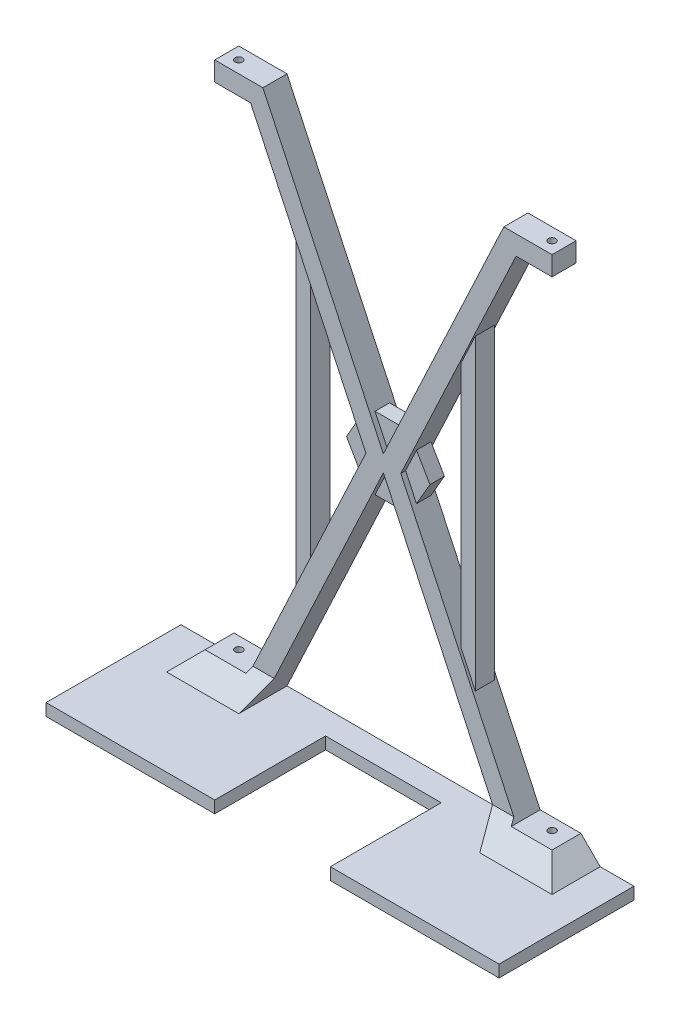
from build123d import *

# Parameters (mm, degrees)
EXTRUDE_1_DEPTH     = 5
SKETCH_2_R          = 1.55
CUT_EXTRUDE_1_DEPTH = 234
EXTRUDE_3_DEPTH     = 3
SKETCH_4_W          = 188
SKETCH_4_H          = 10
EXTRUDE_4_DEPTH     = 5
SKETCH_5_W          = 70
SKETCH_5_H          = 46
EXTRUDE_5_DEPTH     = 5
EXTRUDE_6_DEPTH     = 4
CHAMFER_1_SIZE      = 10


with BuildPart() as part:
    # 草图1 → 凸台-拉伸1 (new, symmetric)
    with BuildSketch(Plane.XY):
        Polygon((-55.084006936, 98.602863112), (-7.242890373, -3.397136888), (0, 0), (-50, 106.602863112), (-70, 106.602863112), (-70, 98.602863112), align=None)
        Polygon((70, 106.602863112), (70, 98.602863112), (55.084006936, 98.602863112), (7.242890373, -3.397136888), (0, 0), (50, 106.602863112), align=None)
        Polygon((-70, -113.397136888), (-70, -105.397136888), (-55.084006936, -105.397136888), (-7.242890373, -3.397136888), (0, -6.794273777), (-50, -113.397136888), align=None)
        Polygon((55.084006936, -105.397136888), (7.242890373, -3.397136888), (0, -6.794273777), (50, -113.397136888), (70, -113.397136888), (70, -105.397136888), align=None)
        Polygon((-7.242890373, -3.397136888), (0, 0), (7.242890373, -3.397136888), align=None)
        Polygon((-7.242890373, -3.397136888), (7.242890373, -3.397136888), (0, -6.794273777), align=None)
    extrude(amount=EXTRUDE_1_DEPTH, both=True)

    # 草图2 → 切除-拉伸1 (cut)
    with BuildSketch(Plane(origin=(0, 106.602863112, 0), x_dir=(1, 0, 0), z_dir=(0, 1, 0))):
        with Locations(Location((-65, 0, 0), (0, 0, 180))):
            Circle(SKETCH_2_R)
        with Locations(Location((65, 0, 0), (0, 0, 180))):
            Circle(SKETCH_2_R)
    extrude(amount=-CUT_EXTRUDE_1_DEPTH, mode=Mode.SUBTRACT)

    # 草图3 → 凸台-拉伸3 (add, symmetric)
    with BuildSketch(Plane.XY):
        Polygon((8.660254038, 11.602863112), (-8.660254038, 11.602863112), (-17.320508076, -3.397136888), (-8.660254038, -18.397136888), (8.660254038, -18.397136888), (17.320508076, -3.397136888), align=None)
    extrude(amount=EXTRUDE_3_DEPTH, both=True)

    # 草图4 → 凸台-拉伸4 (add)
    with BuildSketch(Plane.XZ.offset(113.397136888)):
        Rectangle(SKETCH_4_W, SKETCH_4_H)
    extrude(amount=EXTRUDE_4_DEPTH)

    # 草图5 → 凸台-拉伸5 (add)
    with BuildSketch(Plane.XZ.offset(118.397136888)):
        with Locations((59, 28)):
            Rectangle(SKETCH_5_W, SKETCH_5_H)
        with Locations((-59, 28)):
            Rectangle(SKETCH_5_W, SKETCH_5_H)
    extrude(amount=-EXTRUDE_5_DEPTH)

    # 草图6 → 凸台-拉伸6 (add, symmetric)
    with BuildSketch(Plane.XY):
        Polygon((-31.163448655, 47.602863112), (-31.163448655, -54.397136888), (-37.163448655, -67.189480462), (-37.163448655, 60.395206685), align=None)
        Polygon((37.163448655, -67.189480462), (31.163448655, -54.397136888), (31.163448655, 47.602863112), (37.163448655, 60.395206685), align=None)
    extrude(amount=EXTRUDE_6_DEPTH, both=True)

    # 倒角1
    # the kernel refuses this chamfer: 10 mm, written as the material it adds along each edge
    with BuildSketch(Plane(origin=(-70, -113.397136888, 5), x_dir=(0, -0.0274958766105877, 0.9996219169112968), z_dir=(1, 0, 0))) as chamfer_1_piece_1_section:
        Polygon((CHAMFER_1_SIZE * 0.999621916911, -CHAMFER_1_SIZE * 0.0274958766106), (-CHAMFER_1_SIZE * 0.0274958766106, -CHAMFER_1_SIZE * 0.999621916911), (0, 0), align=None)
    chamfer_1_piece_1 = extrude(amount=45.71682988, mode=Mode.PRIVATE)
    chamfer_1_piece_1 = split(chamfer_1_piece_1, bisect_by=Plane(origin=(-58.48678517, -112.652054934, 8.358509751), z_dir=(-0.9053612966848448, 0.4246421110360305, 0)), keep=Keep.TOP, mode=Mode.PRIVATE)
    chamfer_1_piece_1 = split(chamfer_1_piece_1, bisect_by=Plane(origin=(-63.672942129, -105.397136888, 8.358509751), z_dir=(0, -1, 0)), keep=Keep.TOP, mode=Mode.PRIVATE)
    add(chamfer_1_piece_1)
    with BuildSketch(Plane(origin=(-70, -113.397136888, 5), x_dir=(0, -0.0274958766105877, 0.9996219169112968), z_dir=(1, 0, 0))) as chamfer_1_piece_2_section:
        Polygon((CHAMFER_1_SIZE * 0.999621916911, -CHAMFER_1_SIZE * 0.0274958766106), (-CHAMFER_1_SIZE * 0.0274958766106, -CHAMFER_1_SIZE * 0.999621916911), (0, 0), align=None)
    chamfer_1_piece_2 = extrude(amount=45.71682988, mode=Mode.PRIVATE)
    chamfer_1_piece_2 = split(chamfer_1_piece_2, bisect_by=Plane(origin=(-49.392291056, -112.10146662, 8.457184123), z_dir=(-0.9053612966848449, 0.42464211103603033, 0)), keep=Keep.TOP, mode=Mode.PRIVATE)
    chamfer_1_piece_2 = split(chamfer_1_piece_2, bisect_by=Plane(origin=(-56.635181429, -108.704329732, 8.457184123), z_dir=(0.9053612966848448, -0.4246421110360305, 0)), keep=Keep.TOP, mode=Mode.PRIVATE)
    chamfer_1_piece_2 = split(chamfer_1_piece_2, bisect_by=Plane(origin=(-53.013736242, -105.397136888, 8.457184123), z_dir=(0, -1, 0)), keep=Keep.TOP, mode=Mode.PRIVATE)
    add(chamfer_1_piece_2)
    with BuildSketch(Plane(origin=(-70, -113.397136888, 5), x_dir=(0, -0.0274958766105877, 0.9996219169112968), z_dir=(1, 0, 0))) as chamfer_1_piece_3_section:
        Polygon((CHAMFER_1_SIZE * 0.999621916911, -CHAMFER_1_SIZE * 0.0274958766106), (-CHAMFER_1_SIZE * 0.0274958766106, -CHAMFER_1_SIZE * 0.999621916911), (0, 0), align=None)
    chamfer_1_piece_3 = extrude(amount=45.71682988, mode=Mode.PRIVATE)
    chamfer_1_piece_3 = split(chamfer_1_piece_3, bisect_by=Plane(origin=(-46.659786315, -106.275610043, 5.402318693), z_dir=(-0.9053612966848449, 0.42464211103603033, 0)), keep=Keep.TOP, mode=Mode.PRIVATE)
    chamfer_1_piece_3 = split(chamfer_1_piece_3, bisect_by=Plane(origin=(-53.902676688, -102.878473155, 5.402318693), z_dir=(0.9053612966848448, -0.4246421110360305, 0)), keep=Keep.TOP, mode=Mode.PRIVATE)
    chamfer_1_piece_3 = split(chamfer_1_piece_3, bisect_by=Plane(origin=(-50.281231501, -105.397136888, 5.402318693), z_dir=(0, 1, 0)), keep=Keep.TOP, mode=Mode.PRIVATE)
    add(chamfer_1_piece_3)
    with BuildSketch(Plane(origin=(70, -113.397136888, 5), x_dir=(0, -0.027495876610584936, 0.9996219169112968), z_dir=(-1, 0, 0))) as chamfer_1_piece_4_section:
        Polygon((CHAMFER_1_SIZE * 0.999621916911, CHAMFER_1_SIZE * 0.0274958766106), (-CHAMFER_1_SIZE * 0.0274958766106, CHAMFER_1_SIZE * 0.999621916911), (0, 0), align=None)
    chamfer_1_piece_4 = extrude(amount=45.71682988, mode=Mode.PRIVATE)
    chamfer_1_piece_4 = split(chamfer_1_piece_4, bisect_by=Plane(origin=(63.672942129, -105.397136888, 8.358509751), z_dir=(0, -1, 0)), keep=Keep.TOP, mode=Mode.PRIVATE)
    chamfer_1_piece_4 = split(chamfer_1_piece_4, bisect_by=Plane(origin=(58.48678517, -112.652054934, 8.358509751), z_dir=(0.905361296684845, 0.4246421110360303, 0)), keep=Keep.TOP, mode=Mode.PRIVATE)
    add(chamfer_1_piece_4)
    with BuildSketch(Plane(origin=(70, -113.397136888, 5), x_dir=(0, -0.027495876610584936, 0.9996219169112968), z_dir=(-1, 0, 0))) as chamfer_1_piece_5_section:
        Polygon((CHAMFER_1_SIZE * 0.999621916911, CHAMFER_1_SIZE * 0.0274958766106), (-CHAMFER_1_SIZE * 0.0274958766106, CHAMFER_1_SIZE * 0.999621916911), (0, 0), align=None)
    chamfer_1_piece_5 = extrude(amount=45.71682988, mode=Mode.PRIVATE)
    chamfer_1_piece_5 = split(chamfer_1_piece_5, bisect_by=Plane(origin=(49.392291056, -112.10146662, 8.457184123), z_dir=(0.9053612966848449, 0.4246421110360304, 0)), keep=Keep.TOP, mode=Mode.PRIVATE)
    chamfer_1_piece_5 = split(chamfer_1_piece_5, bisect_by=Plane(origin=(53.013736242, -105.397136888, 8.457184123), z_dir=(0, -1, 0)), keep=Keep.TOP, mode=Mode.PRIVATE)
    chamfer_1_piece_5 = split(chamfer_1_piece_5, bisect_by=Plane(origin=(56.635181429, -108.704329732, 8.457184123), z_dir=(-0.905361296684845, -0.4246421110360303, 0)), keep=Keep.TOP, mode=Mode.PRIVATE)
    add(chamfer_1_piece_5)
    with BuildSketch(Plane(origin=(70, -113.397136888, 5), x_dir=(0, -0.027495876610584936, 0.9996219169112968), z_dir=(-1, 0, 0))) as chamfer_1_piece_6_section:
        Polygon((CHAMFER_1_SIZE * 0.999621916911, CHAMFER_1_SIZE * 0.0274958766106), (-CHAMFER_1_SIZE * 0.0274958766106, CHAMFER_1_SIZE * 0.999621916911), (0, 0), align=None)
    chamfer_1_piece_6 = extrude(amount=45.71682988, mode=Mode.PRIVATE)
    chamfer_1_piece_6 = split(chamfer_1_piece_6, bisect_by=Plane(origin=(46.659786315, -106.275610043, 5.402318693), z_dir=(0.9053612966848449, 0.4246421110360304, 0)), keep=Keep.TOP, mode=Mode.PRIVATE)
    chamfer_1_piece_6 = split(chamfer_1_piece_6, bisect_by=Plane(origin=(50.281231501, -105.397136888, 5.402318693), z_dir=(0, 1, 0)), keep=Keep.TOP, mode=Mode.PRIVATE)
    chamfer_1_piece_6 = split(chamfer_1_piece_6, bisect_by=Plane(origin=(53.902676688, -102.878473155, 5.402318693), z_dir=(-0.905361296684845, -0.4246421110360303, 0)), keep=Keep.TOP, mode=Mode.PRIVATE)
    add(chamfer_1_piece_6)
    with BuildSketch(Plane(origin=(70, -113.397136888, 5), x_dir=(0.9996219169112964, -0.02749587661059736, 0), z_dir=(0, 0, -1))) as chamfer_1_piece_7_section:
        Polygon((CHAMFER_1_SIZE * 0.999621916911, -CHAMFER_1_SIZE * 0.0274958766106), (-CHAMFER_1_SIZE * 0.0274958766106, -CHAMFER_1_SIZE * 0.999621916911), (0, 0), align=None)
    chamfer_1_piece_7 = extrude(amount=10, mode=Mode.PRIVATE)
    chamfer_1_piece_7 = split(chamfer_1_piece_7, bisect_by=Plane(origin=(73.457184123, -105.397136888, 0), z_dir=(0, -1, 0)), keep=Keep.TOP, mode=Mode.PRIVATE)
    add(chamfer_1_piece_7)
    with BuildSketch(Plane(origin=(-70, -113.397136888, -5), x_dir=(-0.9996219169112968, -0.027495876610586317, 0), z_dir=(0, 0, 1))) as chamfer_1_piece_8_section:
        Polygon((CHAMFER_1_SIZE * 0.999621916911, -CHAMFER_1_SIZE * 0.0274958766106), (-CHAMFER_1_SIZE * 0.0274958766106, -CHAMFER_1_SIZE * 0.999621916911), (0, 0), align=None)
    chamfer_1_piece_8 = extrude(amount=10, mode=Mode.PRIVATE)
    chamfer_1_piece_8 = split(chamfer_1_piece_8, bisect_by=Plane(origin=(-73.457184123, -105.397136888, 0), z_dir=(0, -1, 0)), keep=Keep.TOP, mode=Mode.PRIVATE)
    add(chamfer_1_piece_8)
    with BuildSketch(Plane(origin=(-70, -113.397136888, -5), x_dir=(-0.9996219169112968, -0.027495876610586317, 0), z_dir=(0, 0, 1))) as chamfer_1_piece_9a_section:
        Polygon((CHAMFER_1_SIZE * 0.999621916911, -CHAMFER_1_SIZE * 0.0274958766106), (-CHAMFER_1_SIZE * 0.0274958766106, -CHAMFER_1_SIZE * 0.999621916911), (0, 0), align=None)
    chamfer_1_piece_9a = extrude(amount=35.71682988, mode=Mode.PRIVATE)
    chamfer_1_piece_9a = split(chamfer_1_piece_9a, bisect_by=Plane(origin=(-73.457184123, -105.397136888, 17.85841494), z_dir=(0, -1, 0)), keep=Keep.TOP, mode=Mode.PRIVATE)
    chamfer_1_piece_9a = split(chamfer_1_piece_9a, bisect_by=Plane(origin=(-73.457184123, -110.402898176, 5), z_dir=(0, 0, 1)), keep=Keep.TOP, mode=Mode.PRIVATE)
    with BuildSketch(Plane(origin=(-95.71682988, -113.397136888, 5), x_dir=(0, -0.027495876610586317, 0.9996219169112968), z_dir=(1, 0, 0))) as chamfer_1_piece_9b_section:
        Polygon((CHAMFER_1_SIZE * 0.999621916911, -CHAMFER_1_SIZE * 0.0274958766106), (-CHAMFER_1_SIZE * 0.0274958766106, -CHAMFER_1_SIZE * 0.999621916911), (0, 0), align=None)
    chamfer_1_piece_9b = extrude(amount=71.433659759, mode=Mode.PRIVATE)
    chamfer_1_piece_9b = split(chamfer_1_piece_9b, bisect_by=Plane(origin=(-94, -110.402898176, 8.457184123), z_dir=(1, 0, 0)), keep=Keep.TOP, mode=Mode.PRIVATE)
    chamfer_1_piece_9b = split(chamfer_1_piece_9b, bisect_by=Plane(origin=(-82, -105.397136888, 8.457184123), z_dir=(0, -1, 0)), keep=Keep.TOP, mode=Mode.PRIVATE)
    chamfer_1_piece_9b = split(chamfer_1_piece_9b, bisect_by=Plane(origin=(-70, -110.402898176, 8.457184123), z_dir=(-1, 0, 0)), keep=Keep.TOP, mode=Mode.PRIVATE)
    chamfer_1_piece_9 = chamfer_1_piece_9a & chamfer_1_piece_9b
    add(chamfer_1_piece_9)
    with BuildSketch(Plane(origin=(70, -113.397136888, 30.71682988), x_dir=(0.9996219169112968, -0.0274958766105877, 0), z_dir=(0, 0, -1))) as chamfer_1_piece_10a_section:
        Polygon((CHAMFER_1_SIZE * 0.999621916911, -CHAMFER_1_SIZE * 0.0274958766106), (-CHAMFER_1_SIZE * 0.0274958766106, -CHAMFER_1_SIZE * 0.999621916911), (0, 0), align=None)
    chamfer_1_piece_10a = extrude(amount=35.71682988, mode=Mode.PRIVATE)
    chamfer_1_piece_10a = split(chamfer_1_piece_10a, bisect_by=Plane(origin=(73.457184123, -105.397136888, 17.85841494), z_dir=(0, -1, 0)), keep=Keep.TOP, mode=Mode.PRIVATE)
    chamfer_1_piece_10a = split(chamfer_1_piece_10a, bisect_by=Plane(origin=(73.457184123, -110.402898176, 5), z_dir=(0, 0, 1)), keep=Keep.TOP, mode=Mode.PRIVATE)
    with BuildSketch(Plane(origin=(95.71682988, -113.397136888, 5), x_dir=(0, -0.027495876610586317, 0.9996219169112968), z_dir=(-1, 0, 0))) as chamfer_1_piece_10b_section:
        Polygon((CHAMFER_1_SIZE * 0.999621916911, CHAMFER_1_SIZE * 0.0274958766106), (-CHAMFER_1_SIZE * 0.0274958766106, CHAMFER_1_SIZE * 0.999621916911), (0, 0), align=None)
    chamfer_1_piece_10b = extrude(amount=71.433659759, mode=Mode.PRIVATE)
    chamfer_1_piece_10b = split(chamfer_1_piece_10b, bisect_by=Plane(origin=(94, -110.402898176, 8.457184123), z_dir=(-1, 0, 0)), keep=Keep.TOP, mode=Mode.PRIVATE)
    chamfer_1_piece_10b = split(chamfer_1_piece_10b, bisect_by=Plane(origin=(70, -110.402898176, 8.457184123), z_dir=(1, 0, 0)), keep=Keep.TOP, mode=Mode.PRIVATE)
    chamfer_1_piece_10b = split(chamfer_1_piece_10b, bisect_by=Plane(origin=(82, -105.397136888, 8.457184123), z_dir=(0, -1, 0)), keep=Keep.TOP, mode=Mode.PRIVATE)
    chamfer_1_piece_10 = chamfer_1_piece_10a & chamfer_1_piece_10b
    add(chamfer_1_piece_10)


solid = part.part
